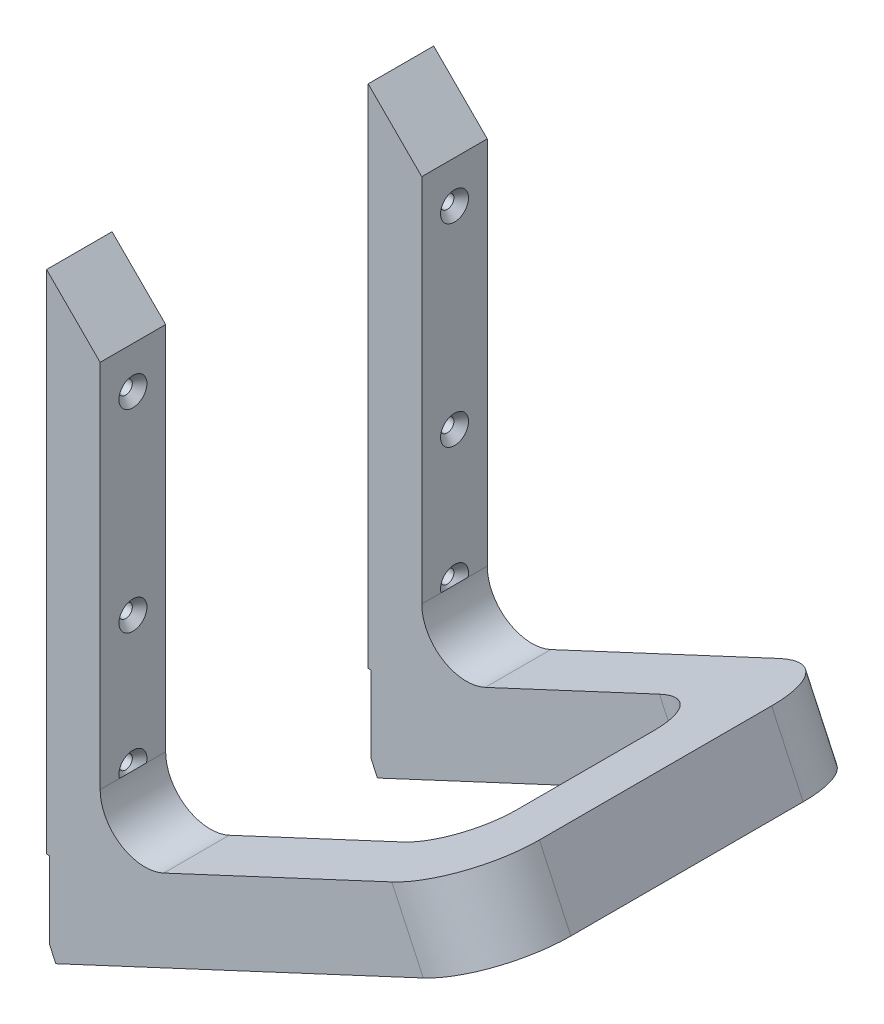
from build123d import *

# Parameters (mm, degrees)
AUFSATZ_LINEAR_AUSTRAGEN1_DEPTH              = 22
AUFSATZ_LINEAR_AUSTRAGEN2_DEPTH              = 25
FORMSENKUNG_F_R_M4_LINSENSENKSCHRAUB_2_COUNT = 2
FORMSENKUNG_F_R_M4_LINSENSENKSCHRAUB_2_PITCH = 109
FORMSENKUNG_F_R_M4_LINSENSENKSCHRAUB_3_COUNT = 2
FORMSENKUNG_F_R_M4_LINSENSENKSCHRAUB_3_PITCH = 65
VERRUNDUNG1_R                                = 20
FASE1_SIZE                                   = 18


with BuildPart() as part:
    # Skizze1 → Aufsatz-Linear austragen1 (new body)
    with BuildSketch(Plane.XY):
        with BuildLine():
            Line((0, 0), (18, 0))
            Line((18, 0), (18, -142.266450527))
            ThreePointArc((18, -142.266450527), (24.940505875, -154.917322215), (39.339273926, -155.861067333))
            Line((39.339273926, -155.861067333), (115.937364916, -120.142790905))
            Line((115.937364916, -120.142790905), (126.502821459, -142.80048558))
            Line((126.502821459, -142.80048558), (3.113091309, -200.338061687))
            Line((3.113091309, -200.338061687), (1, -195.806522752))
            Line((1, -195.806522752), (1, -175))
            Line((1, -175), (1, -170))
            Line((1, -170), (0, -170))
            Line((0, -170), (0, 0))
        make_face()
    aufsatz_linear_austragen1 = extrude(amount=AUFSATZ_LINEAR_AUSTRAGEN1_DEPTH)

    # Skizze2 → Aufsatz-Linear austragen2 (add)
    with BuildSketch(Plane(origin=(77.289946844, -165.748825893, 0), x_dir=(0.9063077870366477, 0.4226182617407045, 0), z_dir=(0.4226182617407045, -0.9063077870366477, 0))):
        with BuildLine():
            Line((54.300399179, 22), (54.300399179, 65))
            Line((54.300399179, 65), (80.300399179, 65))
            Line((80.300399179, 65), (80.300399179, 26))
            ThreePointArc((80.300399179, 26), (72.68517549, 7.615223689), (54.300399179, 0))
            Line((54.300399179, 0), (54.300399179, 22))
        make_face()
    aufsatz_linear_austragen2 = extrude(amount=-AUFSATZ_LINEAR_AUSTRAGEN2_DEPTH)

    # Skizze6 → Formsenkung für M4 Linsensenkschraube mit Schlitz1 (revolve, cut)
    with BuildSketch(Plane(origin=(18, -32, 11), x_dir=(0, 0, -1), z_dir=(0, 1, 0))):
        Polygon((0, 0), (0, 18), (2.25, 18), (2.25, 2.45), (4.7, 0), align=None)
    formsenkung_f_r_m4_linsensenkschraube_mi = revolve(axis=Axis((24.35, -32, 11), (-1, 0, 0)), mode=Mode.SUBTRACT)

    # Formsenkung f_r M4 Linsensenkschraub 2: Formsenkung für M4 Linsensenkschraube mit Schlitz1 ×2
    with Locations(*[(0, -i * FORMSENKUNG_F_R_M4_LINSENSENKSCHRAUB_2_PITCH, 0) for i in range(1, FORMSENKUNG_F_R_M4_LINSENSENKSCHRAUB_2_COUNT)]):
        add(formsenkung_f_r_m4_linsensenkschraube_mi, mode=Mode.SUBTRACT)

    # Formsenkung f_r M4 Linsensenkschraub 3: Formsenkung für M4 Linsensenkschraube mit Schlitz1 ×2
    with Locations(*[(0, -i * FORMSENKUNG_F_R_M4_LINSENSENKSCHRAUB_3_PITCH, 0) for i in range(1, FORMSENKUNG_F_R_M4_LINSENSENKSCHRAUB_3_COUNT)]):
        add(formsenkung_f_r_m4_linsensenkschraube_mi, mode=Mode.SUBTRACT)

    # Spiegeln4: Aufsatz-Linear austragen2 across plane
    add(aufsatz_linear_austragen2.mirror(Plane(origin=(86.351068046, -56.694772515, 65), x_dir=(1, 0, 0), z_dir=(0, 0, -1))))

    # Spiegeln5: Aufsatz-Linear austragen1, Formsenkung für M4 Linsensenkschraube mit Schlitz1 across plane
    add(aufsatz_linear_austragen1.mirror(Plane.XY.offset(65)))
    add(formsenkung_f_r_m4_linsensenkschraube_mi.mirror(Plane.XY.offset(65)), mode=Mode.SUBTRACT)

    # Spiegeln5 copy 1 sketch → Spiegeln5 copy 1 (revolve, cut)
    with BuildSketch(Plane(origin=(18, -141, 119), x_dir=(0, 0, 1), z_dir=(0, 1, 0))):
        Polygon((0, 0), (0, -18), (2.25, -18), (2.25, -2.45), (4.7, 0), align=None)
    revolve(axis=Axis((24.35, -141, 119), (1, 0, 0)), mode=Mode.SUBTRACT)

    # Spiegeln5 copy 2 sketch → Spiegeln5 copy 2 (revolve, cut)
    with BuildSketch(Plane(origin=(18, -97, 119), x_dir=(0, 0, 1), z_dir=(0, 1, 0))):
        Polygon((0, 0), (0, -18), (2.25, -18), (2.25, -2.45), (4.7, 0), align=None)
    revolve(axis=Axis((24.35, -97, 119), (1, 0, 0)), mode=Mode.SUBTRACT)

    # Verrundung1
    verrundung1_edges = [part.edges().sort_by_distance(p)[0] for p in [
        (121.220093187, -131.471638242, 22),
        (121.220093187, -131.471638242, 108),
    ]]
    fillet(verrundung1_edges, radius=VERRUNDUNG1_R)

    # Fase1
    fase1_edges = [part.edges().sort_by_distance(p)[0] for p in [
        (18, 0, 119),
        (18, 0, 11),
    ]]
    chamfer(fase1_edges, length=FASE1_SIZE - 0.0001)  # a hair under: the kernel refuses the full size


solid = part.part
